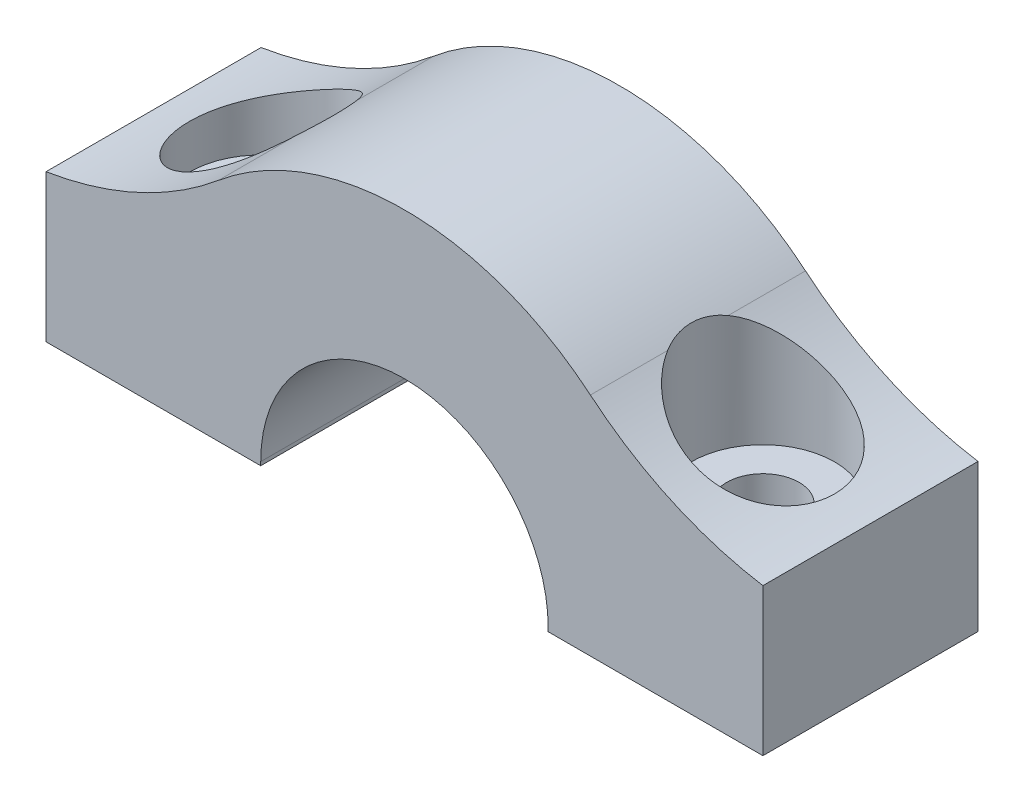
from build123d import *

# Parameters (mm, degrees)
SKETCH1_W           = 20
SKETCH1_H           = 6
BOSS_EXTRUDE1_DEPTH = 4.01
BOSS_EXTRUDE2_DEPTH = 6
SKETCH5_W           = 20
SKETCH5_H           = 6
BOSS_EXTRUDE3_DEPTH = 3
SKETCH6_R           = 4.01
CUT_EXTRUDE2_DEPTH  = 8
SKETCH7_W           = 20
SKETCH7_H           = 6
CUT_EXTRUDE3_DEPTH  = 3
FILLET1_R           = 10
SKETCH8_R           = 1.01
CUT_EXTRUDE4_DEPTH  = 23.393010339
CUT_EXTRUDE5_START  = -3
SKETCH9_R           = 2
CUT_EXTRUDE5_DEPTH  = 10
BOSS_EXTRUDE4_START = 0.1
SKETCH10_W          = 5.99
SKETCH10_H          = 6
SKETCH10_R          = 1.01
BOSS_EXTRUDE4_DEPTH = 0.1


with BuildPart() as part:
    # Sketch1 → Boss-Extrude1 (new body)
    with BuildSketch(Plane(origin=(0, 0, 0), x_dir=(1, 0, 0), z_dir=(0, 1, 0))):
        with Locations((10, 3)):
            Rectangle(SKETCH1_W, SKETCH1_H)
    extrude(amount=BOSS_EXTRUDE1_DEPTH)

    # Sketch2 → Boss-Extrude2 (add)
    with BuildSketch(Plane.XY):
        with BuildLine():
            Line((2.973847991, 4.01), (17.026152009, 4.01))
            ThreePointArc((17.026152009, 4.01), (10, 8.089926579), (2.973847991, 4.01))
        make_face()
    extrude(amount=-BOSS_EXTRUDE2_DEPTH)

    # Sketch5 → Boss-Extrude3 (add)
    with BuildSketch(Plane.XZ):
        with Locations((10, -3)):
            Rectangle(SKETCH5_W, SKETCH5_H)
    extrude(amount=BOSS_EXTRUDE3_DEPTH)

    # Sketch6 → Cut-Extrude2 (cut)
    with BuildSketch(Plane.XY):
        with Locations((10, 0)):
            Circle(SKETCH6_R)
    extrude(amount=-CUT_EXTRUDE2_DEPTH, mode=Mode.SUBTRACT)

    # Sketch7 → Cut-Extrude3 (cut)
    with BuildSketch(Plane.XZ.offset(3)):
        with Locations((10, -3)):
            Rectangle(SKETCH7_W, SKETCH7_H)
    extrude(amount=-CUT_EXTRUDE3_DEPTH, mode=Mode.SUBTRACT)

    # Fillet1
    # the kernel refuses this fillet: 10 mm, written as the material it adds along each edge
    with BuildSketch(Plane(origin=(17.026152009, 4.01, 0), x_dir=(1, 0, 0), z_dir=(0, 0, -1))) as fillet1_piece_1:
        with BuildLine():
            CenterArc((4.573770937, -9.871182633), FILLET1_R, 99.206448973, 30.677642317)
            Line((-1.838595026, -2.197750365), (-1.966842345, -2.04428172))
            ThreePointArc((-1.966842345, -2.04428172), (-0.974617613, -1.052595468), (-0.173701255, 0.099135634))
            Line((-0.173701255, 0.099135634), (0, 0.2))
            ThreePointArc((0, 0.2), (1.486923995, 0.2), (2.941849532, 0.197423653))
            Line((2.941849532, 0.197423653), (2.973847991, 0))
        make_face()
    extrude(amount=6)
    with BuildSketch(Plane(origin=(2.973847991, 4.01, 0), x_dir=(0.6416530517809019, 0.7669950202838707, 0), z_dir=(0, 0, -1))) as fillet1_piece_2:
        with BuildLine():
            CenterArc((4.636373844, -9.841933994), FILLET1_R, 100.200714573, 30.677642317)
            Line((-1.908178639, -2.2809266), (-2.039069689, -2.129706452))
            ThreePointArc((-2.039069689, -2.129706452), (-1.107488324, -1.01213269), (-0.153399004, 0.12833061))
            Line((-0.153399004, 0.12833061), (0.035419403, 0.19683868))
            ThreePointArc((0.035419403, 0.19683868), (1.432701848, 0.072125761), (2.829984292, 0.19683868))
            Line((2.829984292, 0.19683868), (2.865403695, 0))
        make_face()
    extrude(amount=6)

    # Sketch8 → Cut-Extrude4 (cut, through all)
    with BuildSketch(Plane.XZ):
        with Locations(Location((3, -3, 0), (0, 0, 270))):
            Circle(SKETCH8_R)
        with Locations(Location((17, -3, 0), (0, 0, 270))):
            Circle(SKETCH8_R)
    extrude(amount=-CUT_EXTRUDE4_DEPTH, mode=Mode.SUBTRACT)

    # Sketch9 → Cut-Extrude5 (cut)
    with BuildSketch(Plane.XZ.offset(CUT_EXTRUDE5_START)):
        with Locations(Location((3, -3, 0), (0, 0, 270))):
            Circle(SKETCH9_R)
        with Locations(Location((17, -3, 0), (0, 0, 270))):
            Circle(SKETCH9_R)
    extrude(amount=-CUT_EXTRUDE5_DEPTH, mode=Mode.SUBTRACT)

    # Sketch10 → Boss-Extrude4 (add)
    # profile 1 of 2: a face of its own
    with BuildSketch(Plane.XZ.offset(BOSS_EXTRUDE4_START)):
        with Locations((2.995, -3)):
            Rectangle(SKETCH10_W, SKETCH10_H)
        with Locations(Location((3, -3, 0), (0, 0, 270))):
            Circle(SKETCH10_R, mode=Mode.SUBTRACT)
    # profile 2 of 2: a face of its own
    with BuildSketch(Plane.XZ.offset(BOSS_EXTRUDE4_START)):
        with Locations((17.005, -3)):
            Rectangle(SKETCH10_W, SKETCH10_H)
        with Locations(Location((17, -3, 0), (0, 0, 270))):
            Circle(SKETCH10_R, mode=Mode.SUBTRACT)
    extrude(amount=-BOSS_EXTRUDE4_DEPTH)


solid = part.part
